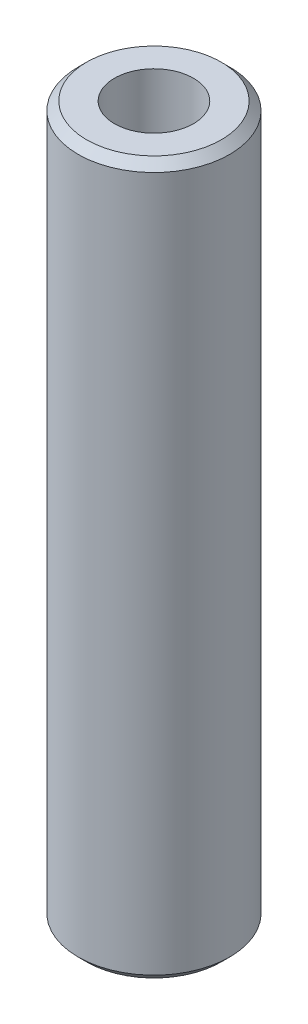
from build123d import *

# Parameters (mm, degrees)
SKETCH1_R           = 42.5
BOSS_EXTRUDE1_DEPTH = 399.389153584
SKETCH2_R           = 22.149996343
CUT_EXTRUDE1_DEPTH  = 404.886365208
CHAMFER1_SIZE       = 4.732102066


with BuildPart() as part:
    # Sketch1 → Boss-Extrude1 (new body)
    with BuildSketch(Plane(origin=(0, 0, 0), x_dir=(1, 0, 0), z_dir=(0, 1, 0))):
        Circle(SKETCH1_R)
    extrude(amount=BOSS_EXTRUDE1_DEPTH)

    # Sketch2 → Cut-Extrude1 (cut, through all)
    with BuildSketch(Plane(origin=(0, 0, 0), x_dir=(1, 0, 0), z_dir=(0, 1, 0))):
        Circle(SKETCH2_R)
    extrude(amount=CUT_EXTRUDE1_DEPTH, mode=Mode.SUBTRACT)

    # Chamfer1
    chamfer1_edges = [part.edges().sort_by_distance(p)[0] for p in [
        (-42.5, 399.389153584, 0),
        (-42.5, 0, 0),
    ]]
    chamfer(chamfer1_edges, length=CHAMFER1_SIZE)


solid = part.part
